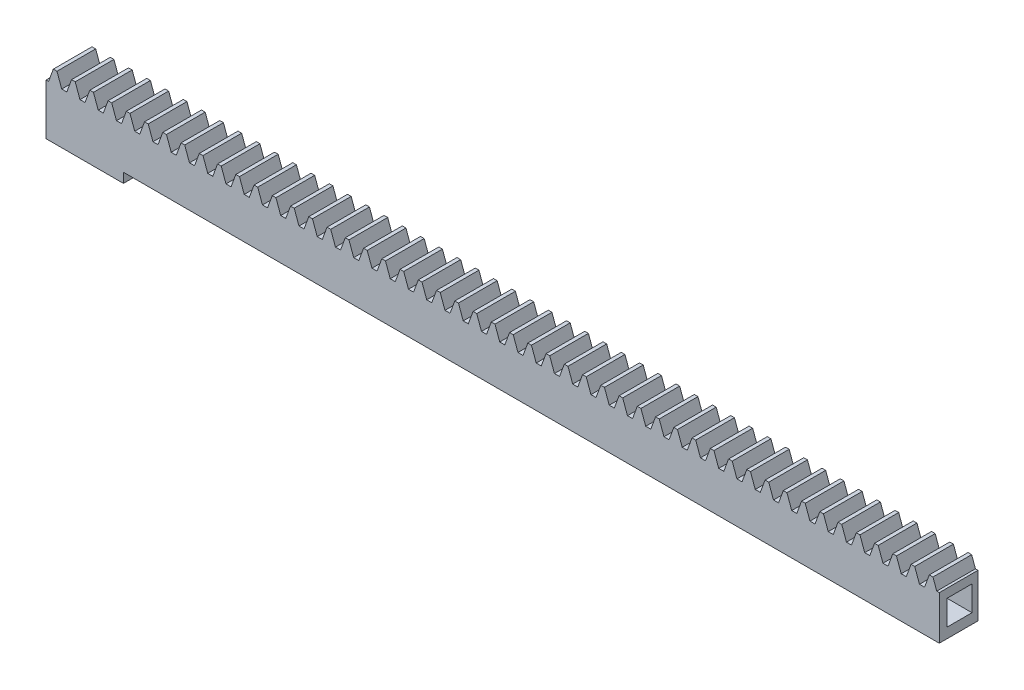
from build123d import *

# Parameters (mm, degrees)
BLANKSKE_W          = 230
BLANKSKE_H          = 14
BLANK_DEPTH         = 10
TOOTHCUTSIM_DEPTH   = 231.642580631
TEETHCUTS_COUNT     = 50
TEETHCUTS_PITCH     = 4.712388975
SKETCH2_W           = 8
SKETCH2_H           = 6.45
CUT_EXTRUDE2_DEPTH  = 230
SKETCH5_W           = 20
SKETCH5_H           = 10
BOSS_EXTRUDE2_DEPTH = 2.5
SKETCH7_R           = 2.1
CUT_EXTRUDE4_DEPTH  = 4.57
SKETCH8_R           = 2.5
CUT_EXTRUDE5_DEPTH  = 0.533836066
BOSS_EXTRUDE3_DEPTH = 0.655
SKETCH10_W          = 7.5
SKETCH10_H          = 1.55
SKETCH10_W_2        = 8.706928691
BOSS_EXTRUDE4_DEPTH = 6.45
CUT_EXTRUDE6_DEPTH  = 8.706928691


with BuildPart() as part:
    # BlankSke → Blank (new body)
    with BuildSketch(Plane.XY):
        with Locations((115, 7)):
            Rectangle(BLANKSKE_W, BLANKSKE_H)
    extrude(amount=-BLANK_DEPTH)

    # TooCutSkeSim → ToothCutSim (cut, through all)
    with BuildSketch(Plane.XY):
        Polygon((0.654653055, 10.625), (-0.654653055, 10.625), (-1.892297439, 14.0254), (1.892297439, 14.0254), align=None)
    toothcutsim = extrude(amount=-TOOTHCUTSIM_DEPTH, mode=Mode.SUBTRACT)

    # TeethCuts: ToothCutSim ×50
    with Locations(*[(i * TEETHCUTS_PITCH, 0, 0) for i in range(1, TEETHCUTS_COUNT)]):
        add(toothcutsim, mode=Mode.SUBTRACT)

    # Sketch2 → Cut-Extrude2 (cut)
    with BuildSketch(Plane(origin=(230, 0, 0), x_dir=(0, 0, -1), z_dir=(1, 0, 0))):
        with Locations((6, 5.828836066)):
            Rectangle(SKETCH2_W, SKETCH2_H)
    extrude(amount=-CUT_EXTRUDE2_DEPTH, mode=Mode.SUBTRACT)

    # Sketch5 → Boss-Extrude2 (add)
    with BuildSketch(Plane.XZ):
        with Locations((10, -5)):
            Rectangle(SKETCH5_W, SKETCH5_H)
    extrude(amount=BOSS_EXTRUDE2_DEPTH)

    # Sketch7 → Cut-Extrude4 (cut)
    with BuildSketch(Plane.XZ.offset(2.5)):
        with Locations(Location((3.039383923, -5.053017901, 0), (0, 0, 270))):
            Circle(SKETCH7_R)
        with Locations(Location((15.739383923, -5.053017901, 0), (0, 0, 270))):
            Circle(SKETCH7_R)
    extrude(amount=-CUT_EXTRUDE4_DEPTH, mode=Mode.SUBTRACT)

    # Sketch8 → Cut-Extrude5 (cut)
    with BuildSketch(Plane(origin=(0, 2.603836066, 0), x_dir=(1, 0, 0), z_dir=(0, 1, 0))):
        with Locations(Location((3.039383923, 5.053017901, 0), (0, 0, 270))):
            Circle(SKETCH8_R)
        with Locations(Location((15.739383923, 5.053017901, 0), (0, 0, 270))):
            Circle(SKETCH8_R)
    extrude(amount=-CUT_EXTRUDE5_DEPTH, mode=Mode.SUBTRACT)

    # Sketch9 → Boss-Extrude3 (add)
    with BuildSketch(Plane(origin=(230, 0, 0), x_dir=(0, 0, -1), z_dir=(1, 0, 0))):
        Polygon((0, 11.318481765), (10, 11.318481765), (10, 9.053836066), (2, 9.053836066), (2, 2.603836066), (10, 2.603836066), (10, 0), (0, 0), align=None)
    extrude(amount=BOSS_EXTRUDE3_DEPTH)

    # Sketch10 → Boss-Extrude4 (add)
    with BuildSketch(Plane(origin=(0, 2.603836066, 0), x_dir=(1, 0, 0), z_dir=(0, 1, 0))):
        with Locations((226.905, 9.225)):
            Rectangle(SKETCH10_W, SKETCH10_H)
        with Locations((6.004959173, 9.225)):
            Rectangle(SKETCH10_W_2, SKETCH10_H)
    extrude(amount=BOSS_EXTRUDE4_DEPTH)

    # Sketch11 → Cut-Extrude6 (cut)
    with BuildSketch(Plane.ZY.offset(-1.651494827)):
        Polygon((-10, 2.603836066), (-8.45, 3.103836066), (-8.45, 9.053836066), (-10, 9.053836066), align=None)
    extrude(amount=-CUT_EXTRUDE6_DEPTH, mode=Mode.SUBTRACT)


solid = part.part
